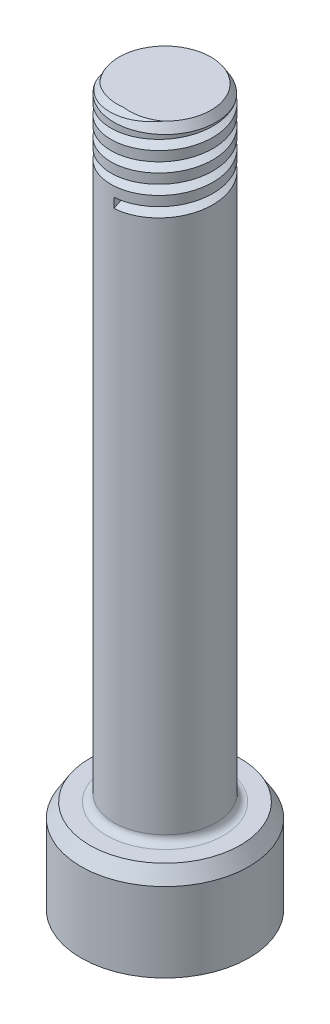
from build123d import *

# Parameters (mm, degrees)
CUT_SWEEP1_PITCH   = 0.793751588
CUT_EXTRUDE1_DEPTH = 1.955803912
FILLET1_R          = 0.30480061
FILLET2_R          = 0.396875794
CHAMFER3_SIZE      = 0.127


with BuildPart() as part:
    # Sketch1 → Revolve1 (revolve)
    with BuildSketch(Plane.XY, mode=Mode.PRIVATE) as revolve1_sk:
        Polygon((0, 0), (0, 29.565608331), (2.082804166, 29.565608331), (2.082804166, 4.165608331), (3.429006858, 4.165608331), (3.429006858, 0), align=None)
    revolve(revolve1_sk.sketch.rotate(Axis((0, 0, 0), (0, 1, 0)), 90), axis=Axis((0, 0, 0), (0, 1, 0)))

    # Cut-Sweep1: arcs per turn and ends read off the stored shape
    # Cut-Sweep1: the profile of Sketch3 profile screwed along a right-hand helix through 4.999992 turns, 8 arcs to a turn; built about Z, then put on its axis
    cut_sweep1_z = Axis((0, 0, 0), (0, 0, 1))
    cut_sweep1_corners = [(2.083104166, 0, -0.595163691), (2.083104166, 0, -0.992339484), (1.685928372, 0, -0.793751588)]
    with BuildLine(mode=Mode.PRIVATE) as cut_sweep1_profile:
        Line(cut_sweep1_corners[0], cut_sweep1_corners[1])
        Line(cut_sweep1_corners[1], cut_sweep1_corners[2])
        Line(cut_sweep1_corners[2], cut_sweep1_corners[0])
    cut_sweep1_cap = Face(cut_sweep1_profile.wire())
    cut_sweep1_turn_angles = [0, 22.5, 45, 67.5, 90, 112.5, 135, 157.5, 180, 202.5, 225, 247.5, 270, 292.5, 315, 337.5, 360]
    cut_sweep1_turn_weights = [1, 0.9238795325112867, 1, 0.9238795325112867, 1, 0.9238795325112867, 1, 0.9238795325112867, 1, 0.9238795325112867, 1, 0.9238795325112867, 1, 0.9238795325112867, 1, 0.9238795325112867, 1]
    cut_sweep1_turn_rails = [Edge.make_bspline([Vector(p[0], p[1], 0).rotate(cut_sweep1_z, cut_sweep1_turn_angles[k]) / cut_sweep1_turn_weights[k] + Vector(0, 0, p[2] + CUT_SWEEP1_PITCH * cut_sweep1_turn_angles[k] / 360) for k in range(17)], [0, 0, 0, 1, 1, 2, 2, 3, 3, 4, 4, 5, 5, 6, 6, 7, 7, 8, 8, 8], 2, cut_sweep1_turn_weights) for p in cut_sweep1_corners]
    cut_sweep1_turn_sides = [Face.make_surface_from_curves(cut_sweep1_turn_rails[p[0]], cut_sweep1_turn_rails[p[1]]) for p in [(0, 1), (1, 2), (2, 0)]]
    cut_sweep1_last_angles = [1440, 1462.5, 1485, 1507.5, 1530, 1552.5, 1575, 1597.5, 1620, 1642.5, 1665, 1687.5, 1710, 1732.5, 1755, 1777.4985, 1799.997]
    cut_sweep1_last_weights = [1, 0.9238795325112867, 1, 0.9238795325112867, 1, 0.9238795325112867, 1, 0.9238795325112867, 1, 0.9238795325112867, 1, 0.9238795325112867, 1, 0.9238795325112867, 1, 0.9238895508235082, 1]
    cut_sweep1_last_rails = [Edge.make_bspline([Vector(p[0], p[1], 0).rotate(cut_sweep1_z, cut_sweep1_last_angles[k]) / cut_sweep1_last_weights[k] + Vector(0, 0, p[2] + CUT_SWEEP1_PITCH * cut_sweep1_last_angles[k] / 360) for k in range(17)], [0, 0, 0, 1, 1, 2, 2, 3, 3, 4, 4, 5, 5, 6, 6, 7, 7, 8, 8, 8], 2, cut_sweep1_last_weights) for p in cut_sweep1_corners]
    cut_sweep1_last_sides = [Face.make_surface_from_curves(cut_sweep1_last_rails[p[0]], cut_sweep1_last_rails[p[1]]) for p in [(0, 1), (1, 2), (2, 0)]]
    cut_sweep1 = Plane(origin=(0, 29.565608331, 0), x_dir=(0, 0, 1), z_dir=(0, -1, 0)) * Solid(Shell([*[p.moved(Location((0, 0, CUT_SWEEP1_PITCH * i))) for i in range(4) for p in cut_sweep1_turn_sides], *cut_sweep1_last_sides, cut_sweep1_cap, cut_sweep1_cap.rotate(cut_sweep1_z, 1799.997).moved(Location((0, 0, CUT_SWEEP1_PITCH * 1799.997 / 360)))]))
    add(cut_sweep1, mode=Mode.SUBTRACT)

    # Sketch4 → Cut-Extrude1 (cut)
    with BuildSketch(Plane(origin=(0, 0, 0), x_dir=(1, 0, 0), z_dir=(0, 1, 0))):
        Polygon((0, 2.06772639), (-1.790703581, 1.033863195), (-1.790703581, -1.033863195), (0, -2.06772639), (1.790703581, -1.033863195), (1.790703581, 1.033863195), align=None)
    extrude(amount=CUT_EXTRUDE1_DEPTH, mode=Mode.SUBTRACT)

    # Fillet1
    fillet1_edges = [part.edges().sort_by_distance(p)[0] for p in [
        (0, 4.165608331, 2.082804166),
    ]]
    fillet(fillet1_edges, radius=FILLET1_R)

    # Fillet2
    fillet2_edges = [part.edges().sort_by_distance(p)[0] for p in [
        (1.790703581, 0.977901956, -1.033863195),
        (0, 0.977901956, -2.06772639),
        (-1.790703581, 0.977901956, -1.033863195),
        (-1.790703581, 0.977901956, 1.033863195),
        (0, 0.977901956, 2.06772639),
        (1.790703581, 0.977901956, 1.033863195),
        (0.895351791, 1.955803912, -1.550794792),
        (-0.895351791, 1.955803912, -1.550794792),
        (-1.790703581, 1.955803912, 0),
        (-0.895351791, 1.955803912, 1.550794792),
        (0.895351791, 1.955803912, 1.550794792),
        (1.790703581, 1.955803912, 0),
    ]]
    fillet(fillet2_edges, radius=FILLET2_R)

    # Chamfer1: read off the stored shape, not the designer's step
    # Chamfer1 outline → Chamfer1 (revolve, cut)
    with BuildSketch(Plane.XY):
        Polygon((2.082804166, 29.565608331), (1.879603759, 29.565608331), (2.082804166, 29.236469354), align=None)
    revolve(axis=Axis((0, 0, 0), (0, 1, 0)), mode=Mode.SUBTRACT)

    # Chamfer2: read off the stored shape, not the designer's step
    # Chamfer2 outline → Chamfer2 (revolve, cut)
    with BuildSketch(Plane.XY):
        Polygon((2.853013648, 0), (3.429006858, 0), (3.429006858, 0.355600711), align=None)
        Polygon((3.073406147, 4.165608331), (3.429006858, 3.589615121), (3.429006858, 4.165608331), align=None)
    revolve(axis=Axis((0, 0, 0), (0, 1, 0)), mode=Mode.SUBTRACT)

    # Chamfer3
    chamfer3_edges = [part.edges().sort_by_distance(p)[0] for p in [
        (0.895351791, 0, -1.550794792),
        (-0.895351791, 0, -1.550794792),
        (-1.790703581, 0, 0),
        (-0.895351791, 0, 1.550794792),
        (0.895351791, 0, 1.550794792),
        (1.790703581, 0, 0),
        (0, 0, -2.006329491),
        (1.737532307, 0, -1.003164745),
        (1.737532307, 0, 1.003164745),
        (0, 0, 2.006329491),
        (-1.737532307, 0, 1.003164745),
        (-1.737532307, 0, -1.003164745),
    ]]
    chamfer(chamfer3_edges, length=CHAMFER3_SIZE)


solid = part.part
